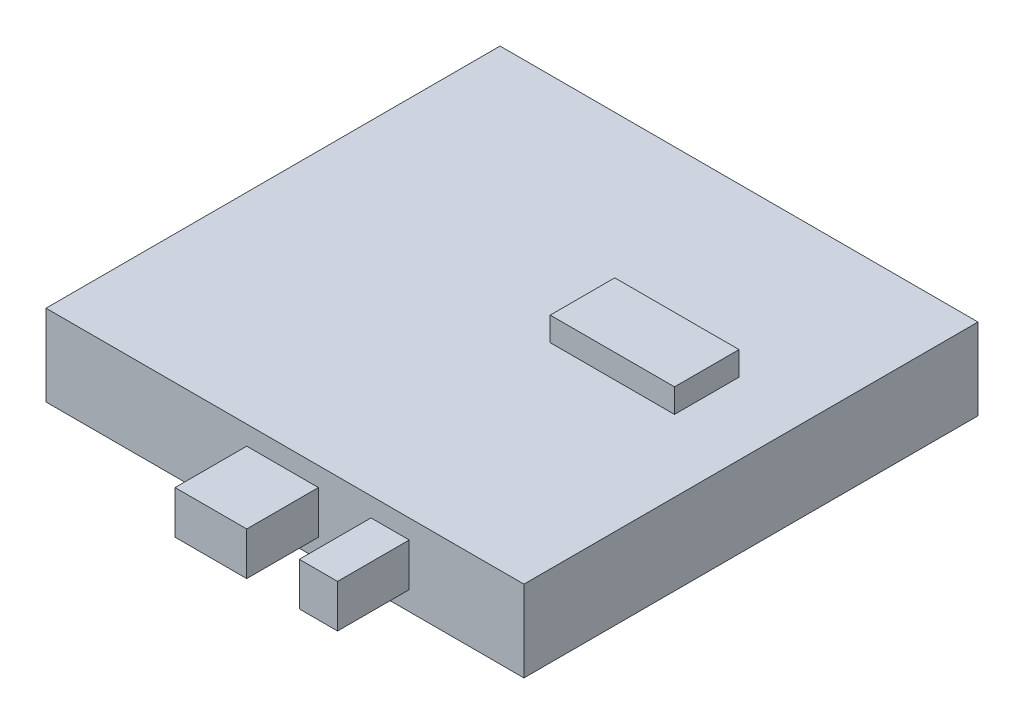
from build123d import *

# Parameters (mm, degrees)
BOSS_EXTRUDE9_DEPTH  = 17
SKETCH5_W            = 26
SKETCH5_H            = 13.5
BOSS_EXTRUDE10_DEPTH = 5
SKETCH6_W            = 15
SKETCH6_H            = 15
SKETCH6_W_2          = 8
CUT_EXTRUDE1_DEPTH   = 4
SKETCH7_W            = 15
SKETCH7_H            = 15
SKETCH7_W_2          = 8
CUT_EXTRUDE2_DEPTH   = 4


with BuildPart() as part:
    # Sketch1 → Boss-Extrude9 (new body)
    with BuildSketch(Plane(origin=(0, 0, 0), x_dir=(1, 0, 0), z_dir=(0, 1, 0))):
        Polygon((24.931466627, -58.41497766), (24.931466627, -43.41497766), (35.931466627, -43.41497766), (35.931466627, -58.41497766), (43.931466627, -58.41497766), (43.931466627, -43.41497766), (67.931466627, -43.41497766), (67.931466627, 51.58502234), (-32.068533373, 51.58502234), (-32.068533373, -43.41497766), (9.931466627, -43.41497766), (9.931466627, -58.41497766), align=None)
    extrude(amount=BOSS_EXTRUDE9_DEPTH)

    # Sketch5 → Boss-Extrude10 (add)
    with BuildSketch(Plane(origin=(0, 17, 0), x_dir=(1, 0, 0), z_dir=(0, 1, 0))):
        with Locations((39.931466627, 9.83502234)):
            Rectangle(SKETCH5_W, SKETCH5_H)
    extrude(amount=BOSS_EXTRUDE10_DEPTH)

    # Sketch6 → Cut-Extrude1 (cut)
    with BuildSketch(Plane(origin=(0, 17, 0), x_dir=(1, 0, 0), z_dir=(0, 1, 0))):
        with Locations((17.431466627, -50.91497766)):
            Rectangle(SKETCH6_W, SKETCH6_H)
        with Locations((39.931466627, -50.91497766)):
            Rectangle(SKETCH6_W_2, SKETCH6_H)
    extrude(amount=-CUT_EXTRUDE1_DEPTH, mode=Mode.SUBTRACT)

    # Sketch7 → Cut-Extrude2 (cut)
    with BuildSketch(Plane.XZ):
        with Locations((17.431466627, 50.91497766)):
            Rectangle(SKETCH7_W, SKETCH7_H)
        with Locations((39.931466627, 50.91497766)):
            Rectangle(SKETCH7_W_2, SKETCH7_H)
    extrude(amount=-CUT_EXTRUDE2_DEPTH, mode=Mode.SUBTRACT)


solid = part.part
